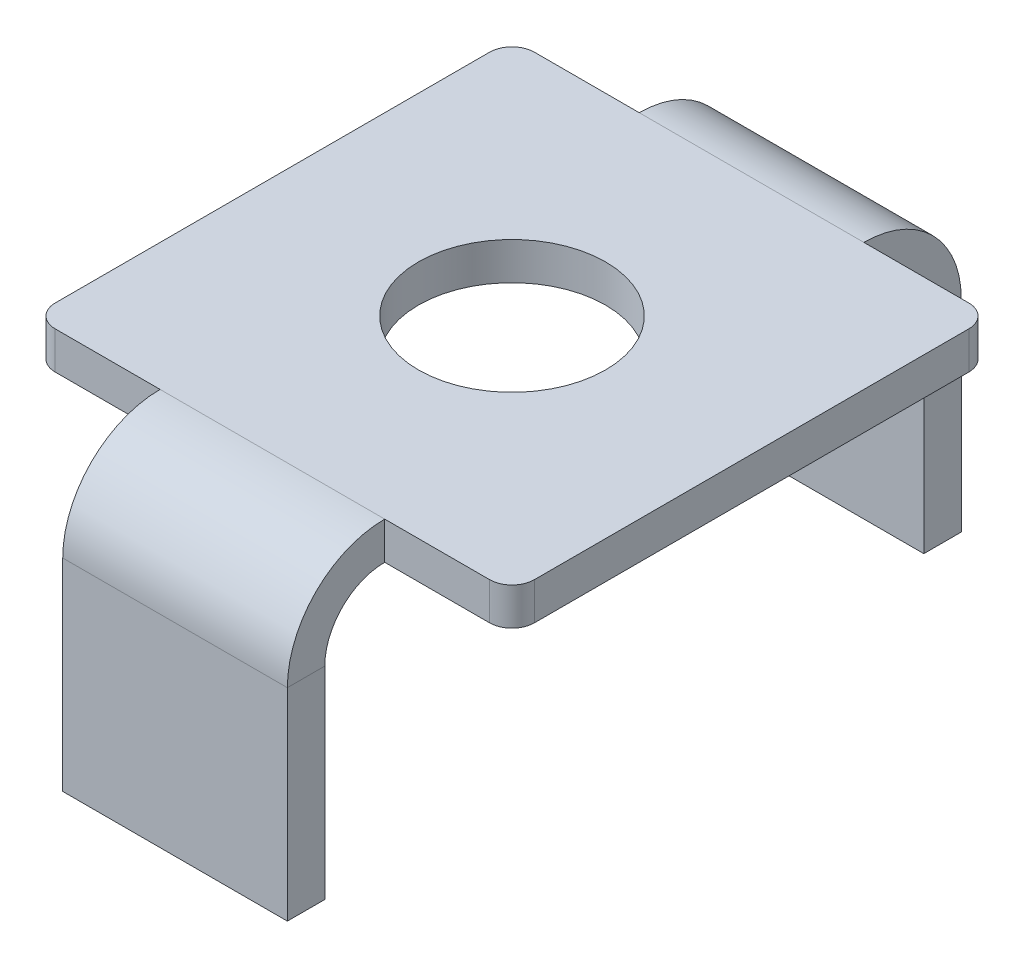
from build123d import *

# Parameters (mm, degrees)
SKETCH1_W             = 6.4
SKETCH1_H             = 6.4
BOSS_EXTRUDE1_DEPTH   = 0.5
M3X0_5_TAPPED_HOLE1_D = 2.5
EDGE_FLANGE1_DEPTH    = 3
FILLET1_R             = 0.3


# Sheet-metal steps are written as plain solids
with BuildPart() as part:
    # Sketch1 → Boss-Extrude1 (new body)
    with BuildSketch(Plane(origin=(0, 0, 0), x_dir=(1, 0, 0), z_dir=(0, 1, 0))):
        Rectangle(SKETCH1_W, SKETCH1_H)
    extrude(amount=BOSS_EXTRUDE1_DEPTH)

    # M3x0.5 Tapped Hole1 (through all)
    with Locations(Plane(origin=(0, 0.5, 0), x_dir=(1, 0, 0), z_dir=(0, 1, 0))):
        with Locations((0, 0)):
            Hole(M3X0_5_TAPPED_HOLE1_D / 2)

    # Edge-Flange1 section (across the edge) → Edge-Flange1 (add)
    with BuildSketch(Plane(origin=(1.5, 0, 4), x_dir=(0, 0, -1), z_dir=(-1, 0, 0))):
        with BuildLine():
            Line((-0.5, 0.8), (-0.5, 3.5))
            Line((-0.5, 3.5), (0, 3.5))
            Line((0, 3.5), (0, 0.8))
            ThreePointArc((0, 0.8), (0.234314575, 0.234314575), (0.8, 0))
            Line((0.8, 0), (0.8, -0.5))
            ThreePointArc((0.8, -0.5), (-0.119238816, -0.119238816), (-0.5, 0.8))
        make_face()
    edge_flange1 = extrude(amount=EDGE_FLANGE1_DEPTH)

    # Mirror1: Edge-Flange1 across plane
    add(edge_flange1.mirror(Plane.XY))

    # Fillet1
    fillet1_edges = [part.edges().sort_by_distance(p)[0] for p in [
        (-3.2, 0.25, 3.2),
        (3.2, 0.25, 3.2),
        (3.2, 0.25, -3.2),
        (-3.2, 0.25, -3.2),
    ]]
    fillet(fillet1_edges, radius=FILLET1_R)


solid = part.part
